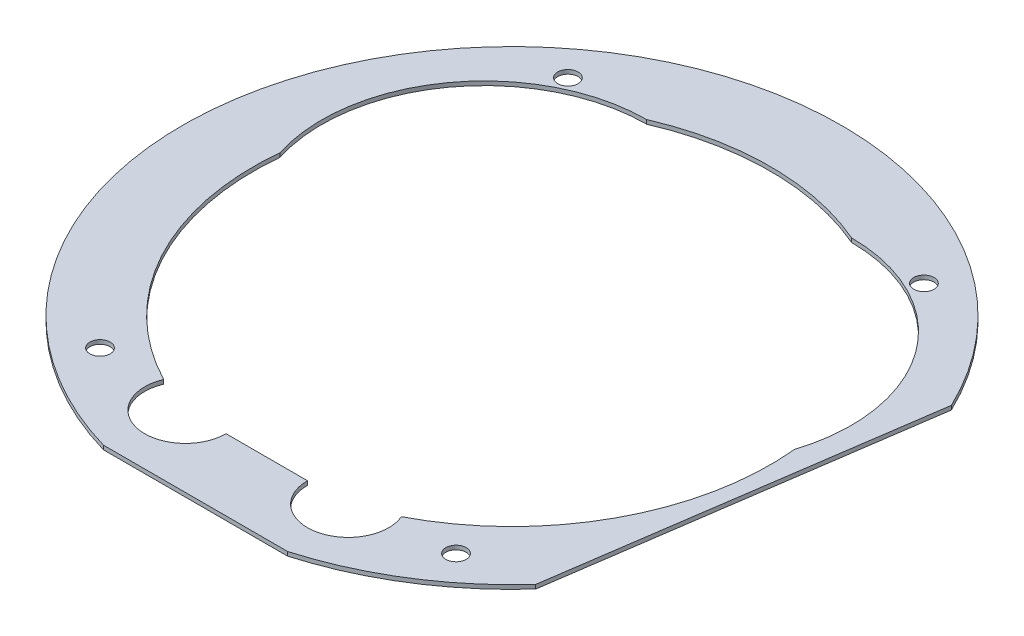
from build123d import *

# Parameters (mm, degrees)
SKETCH1_R           = 1
BOSS_EXTRUDE1_DEPTH = 0.4


with BuildPart() as part:
    # Sketch1 → Boss-Extrude1 (new body)
    with BuildSketch(Plane(origin=(0, 0, 0), x_dir=(1, 0, 0), z_dir=(0, 1, 0))):
        with BuildLine():
            Line((29.237843605, 13.960963482), (24.049079653, -21.711788683))
            ThreePointArc((24.049079653, -21.711788683), (17.208573183, -27.452231403), (9.060814288, -31.107260317))
            Line((9.060814288, -31.107260317), (-9.060814288, -31.107260317))
            ThreePointArc((-9.060814288, -31.107260317), (-24.689356555, 20.980840614), (29.237843605, 13.960963482))
        make_face()
        with Locations((-17.5, 23)):
            Circle(SKETCH1_R, mode=Mode.SUBTRACT)
        with Locations((-17.5, -23)):
            Circle(SKETCH1_R, mode=Mode.SUBTRACT)
        with Locations((17.5, -23)):
            Circle(SKETCH1_R, mode=Mode.SUBTRACT)
        with Locations((17.5, 23)):
            Circle(SKETCH1_R, mode=Mode.SUBTRACT)
        with BuildLine():
            Line((-4, -24.107260317), (4, -24.107260317))
            ThreePointArc((4, -24.107260317), (8.793181532, -28.027829543), (11.685431528, -22.552398764))
            ThreePointArc((11.685431528, -22.552398764), (22.322260414, -12.119269368), (25.278249932, 2.483964648))
            ThreePointArc((25.278249932, 2.483964648), (22.94946525, 16.751850386), (10.070205507, 23.31846824))
            ThreePointArc((10.070205507, 23.31846824), (0, 25.4), (-10.070205507, 23.31846824))
            ThreePointArc((-10.070205507, 23.31846824), (-22.94946525, 16.751850386), (-25.278249932, 2.483964648))
            ThreePointArc((-25.278249932, 2.483964648), (-22.322260414, -12.119269368), (-11.685431528, -22.552398764))
            ThreePointArc((-11.685431528, -22.552398764), (-8.793181532, -28.027829543), (-4, -24.107260317))
        make_face(mode=Mode.SUBTRACT)
    extrude(amount=BOSS_EXTRUDE1_DEPTH)


solid = part.part
